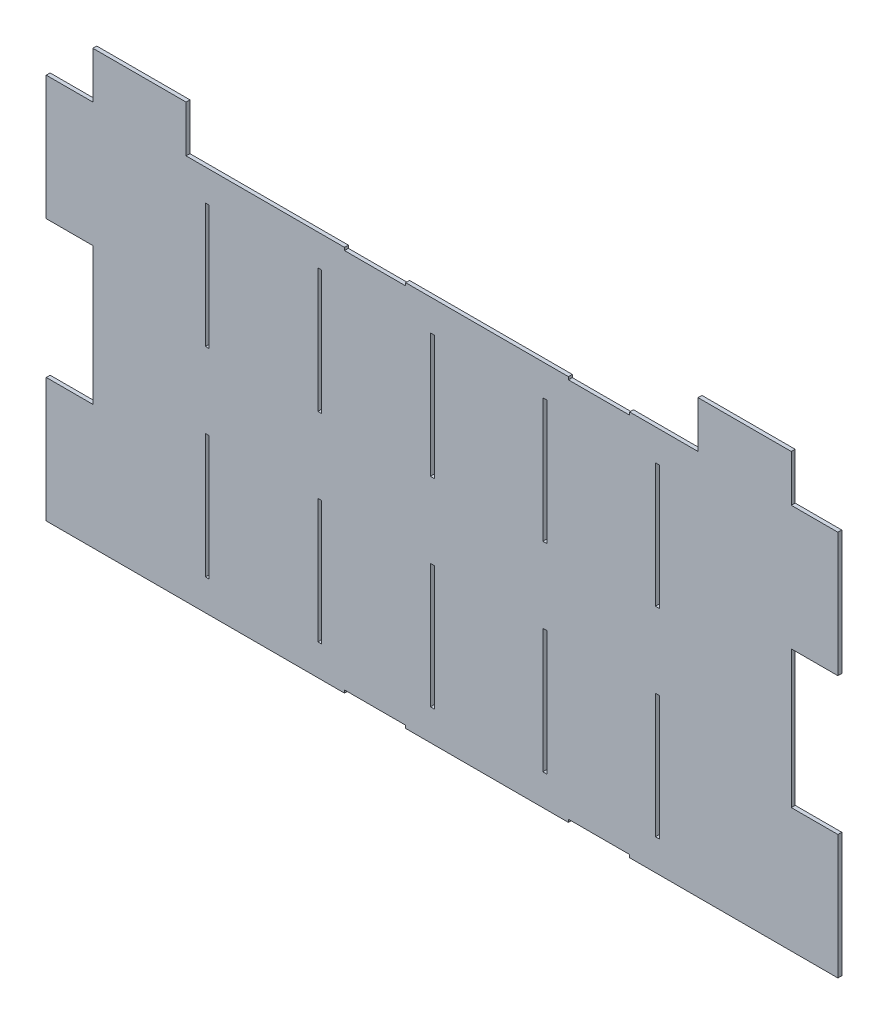
from build123d import *

# Parameters (mm, degrees)
SKETCH1_W                 = 570.860988324
SKETCH1_H                 = 315.575
BOSS_EXTRUDE1_DEPTH       = 3.175
SKETCH2_W                 = 3.175
SKETCH2_H                 = 101.6
CUT_EXTRUDE1_DEPTH        = 3.175
SKETCH7_W                 = 50
SKETCH7_H                 = 2.286
CUT_EXTRUDE5_DEPTH        = 3.175
LPATTERN2_COPY_1_SKETCH_W = 3.175
LPATTERN2_COPY_1_SKETCH_H = 101.6
LPATTERN2_COPY_1_DEPTH    = 3.175
LPATTERN2_COPY_2_SKETCH_W = 3.175
LPATTERN2_COPY_2_SKETCH_H = 101.6
LPATTERN2_COPY_2_DEPTH    = 3.175
LPATTERN2_COPY_3_SKETCH_W = 3.175
LPATTERN2_COPY_3_SKETCH_H = 101.6
LPATTERN2_COPY_3_DEPTH    = 3.175
LPATTERN2_COPY_4_SKETCH_W = 3.175
LPATTERN2_COPY_4_SKETCH_H = 101.6
LPATTERN2_COPY_4_DEPTH    = 3.175
LPATTERN2_COPY_5_SKETCH_W = 3.175
LPATTERN2_COPY_5_SKETCH_H = 101.6
LPATTERN2_COPY_5_DEPTH    = 3.175
LPATTERN2_COPY_6_SKETCH_W = 3.175
LPATTERN2_COPY_6_SKETCH_H = 101.6
LPATTERN2_COPY_6_DEPTH    = 3.175
LPATTERN2_COPY_7_SKETCH_W = 3.175
LPATTERN2_COPY_7_SKETCH_H = 101.6
LPATTERN2_COPY_7_DEPTH    = 3.175
LPATTERN2_COPY_8_SKETCH_W = 3.175
LPATTERN2_COPY_8_SKETCH_H = 101.6
LPATTERN2_COPY_8_DEPTH    = 3.175
SKETCH9_W                 = 76.2
SKETCH9_H                 = 38.1
SKETCH9_W_2               = 38.1
SKETCH9_H_2               = 101.6
BOSS_EXTRUDE3_DEPTH       = 3.175


with BuildPart() as part:
    # Sketch1 → Boss-Extrude1 (new body)
    with BuildSketch(Plane.XY):
        Rectangle(SKETCH1_W, SKETCH1_H)
    extrude(amount=BOSS_EXTRUDE1_DEPTH)

    # Sketch2 → Cut-Extrude1 (cut)
    with BuildSketch(Plane.XY.offset(3.175)):
        with Locations((-191.887994162, -81.5875)):
            Rectangle(SKETCH2_W, SKETCH2_H)
    cut_extrude1 = extrude(amount=-CUT_EXTRUDE1_DEPTH, mode=Mode.SUBTRACT)

    # Sketch7 → Cut-Extrude5 (cut)
    with BuildSketch(Plane.XY.offset(3.175)):
        with Locations((128.2695, -156.6445)):
            Rectangle(SKETCH7_W, SKETCH7_H)
        with Locations((-54.7305, -156.6445)):
            Rectangle(SKETCH7_W, SKETCH7_H)
    cut_extrude5 = extrude(amount=-CUT_EXTRUDE5_DEPTH, mode=Mode.SUBTRACT)

    # Mirror3: Cut-Extrude1 across plane
    add(cut_extrude1.mirror(Plane.ZX), mode=Mode.SUBTRACT)

    # LPattern2 copy 1 sketch → LPattern2 copy 1 (cut)
    with BuildSketch(Plane(origin=(91.96, 0, 3.175), x_dir=(1, 0, 0), z_dir=(0, 0, 1))):
        with Locations((-191.887994162, 81.5875)):
            Rectangle(LPATTERN2_COPY_1_SKETCH_W, LPATTERN2_COPY_1_SKETCH_H)
    extrude(amount=-LPATTERN2_COPY_1_DEPTH, mode=Mode.SUBTRACT)

    # LPattern2 copy 2 sketch → LPattern2 copy 2 (cut)
    with BuildSketch(Plane(origin=(183.92, 0, 3.175), x_dir=(1, 0, 0), z_dir=(0, 0, 1))):
        with Locations((-191.887994162, 81.5875)):
            Rectangle(LPATTERN2_COPY_2_SKETCH_W, LPATTERN2_COPY_2_SKETCH_H)
    extrude(amount=-LPATTERN2_COPY_2_DEPTH, mode=Mode.SUBTRACT)

    # LPattern2 copy 3 sketch → LPattern2 copy 3 (cut)
    with BuildSketch(Plane(origin=(275.88, 0, 3.175), x_dir=(1, 0, 0), z_dir=(0, 0, 1))):
        with Locations((-191.887994162, 81.5875)):
            Rectangle(LPATTERN2_COPY_3_SKETCH_W, LPATTERN2_COPY_3_SKETCH_H)
    extrude(amount=-LPATTERN2_COPY_3_DEPTH, mode=Mode.SUBTRACT)

    # LPattern2 copy 4 sketch → LPattern2 copy 4 (cut)
    with BuildSketch(Plane(origin=(367.84, 0, 3.175), x_dir=(1, 0, 0), z_dir=(0, 0, 1))):
        with Locations((-191.887994162, 81.5875)):
            Rectangle(LPATTERN2_COPY_4_SKETCH_W, LPATTERN2_COPY_4_SKETCH_H)
    extrude(amount=-LPATTERN2_COPY_4_DEPTH, mode=Mode.SUBTRACT)

    # LPattern2 copy 5 sketch → LPattern2 copy 5 (cut)
    with BuildSketch(Plane(origin=(91.96, 0, 3.175), x_dir=(1, 0, 0), z_dir=(0, 0, 1))):
        with Locations((-191.887994162, -81.5875)):
            Rectangle(LPATTERN2_COPY_5_SKETCH_W, LPATTERN2_COPY_5_SKETCH_H)
    extrude(amount=-LPATTERN2_COPY_5_DEPTH, mode=Mode.SUBTRACT)

    # LPattern2 copy 6 sketch → LPattern2 copy 6 (cut)
    with BuildSketch(Plane(origin=(183.92, 0, 3.175), x_dir=(1, 0, 0), z_dir=(0, 0, 1))):
        with Locations((-191.887994162, -81.5875)):
            Rectangle(LPATTERN2_COPY_6_SKETCH_W, LPATTERN2_COPY_6_SKETCH_H)
    extrude(amount=-LPATTERN2_COPY_6_DEPTH, mode=Mode.SUBTRACT)

    # LPattern2 copy 7 sketch → LPattern2 copy 7 (cut)
    with BuildSketch(Plane(origin=(275.88, 0, 3.175), x_dir=(1, 0, 0), z_dir=(0, 0, 1))):
        with Locations((-191.887994162, -81.5875)):
            Rectangle(LPATTERN2_COPY_7_SKETCH_W, LPATTERN2_COPY_7_SKETCH_H)
    extrude(amount=-LPATTERN2_COPY_7_DEPTH, mode=Mode.SUBTRACT)

    # LPattern2 copy 8 sketch → LPattern2 copy 8 (cut)
    with BuildSketch(Plane(origin=(367.84, 0, 3.175), x_dir=(1, 0, 0), z_dir=(0, 0, 1))):
        with Locations((-191.887994162, -81.5875)):
            Rectangle(LPATTERN2_COPY_8_SKETCH_W, LPATTERN2_COPY_8_SKETCH_H)
    extrude(amount=-LPATTERN2_COPY_8_DEPTH, mode=Mode.SUBTRACT)

    # Sketch9 → Boss-Extrude3 (add)
    with BuildSketch(Plane(origin=(0, 0, 0), x_dir=(-1, 0, 0), z_dir=(0, 0, -1))):
        with Locations((-247.330494162, 176.8375)):
            Rectangle(SKETCH9_W, SKETCH9_H)
        Polygon((-285.430494162, 56.1875), (-285.430494162, 157.7875), (-304.480494162, 157.7875), (-323.530494162, 157.7875), (-323.530494162, 56.1875), align=None)
        with Locations((-304.480494162, -106.9875)):
            Rectangle(SKETCH9_W_2, SKETCH9_H_2)
    boss_extrude3 = extrude(amount=-BOSS_EXTRUDE3_DEPTH)

    # Mirror4: Boss-Extrude3 across plane
    add(boss_extrude3.mirror(Plane(origin=(0, 0, 0), x_dir=(0, 0, 1), z_dir=(1, 0, 0))))

    # Mirror5: Cut-Extrude5 across plane
    add(cut_extrude5.mirror(Plane.ZX), mode=Mode.SUBTRACT)


solid = part.part
